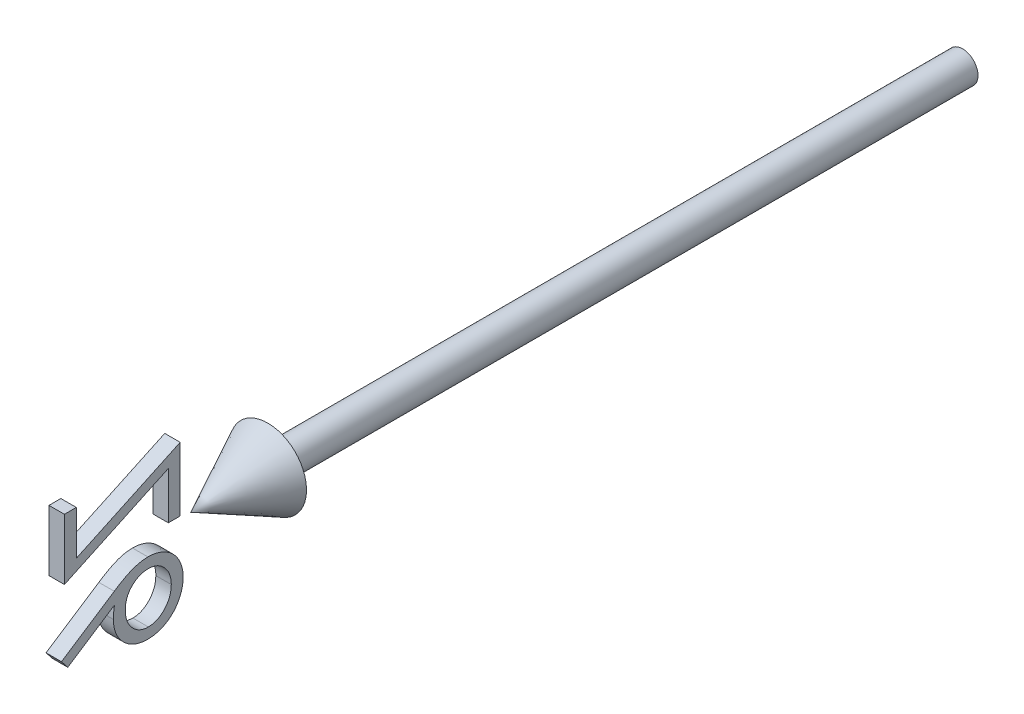
from build123d import *

# Parameters (mm, degrees)
BOSS_EXTRUDE1_DEPTH        = 1
BOSS_EXTRUDE1_DEPTH_BACK   = 1
BOSS_EXTRUDE1_2_DEPTH      = 1
BOSS_EXTRUDE1_2_DEPTH_BACK = 1


with BuildPart() as part:
    # Sketch2 → Revolve1 (revolve)
    with BuildSketch(Plane(origin=(0, 0, 0), x_dir=(1, 0, 0), z_dir=(0, 1, 0))):
        Polygon((0, -100), (5, -90), (2, -90), (2, 0), (0, 0), align=None)
    revolve(axis=Axis((0, 0, -41.949952025), (0, 0, 1)))


with BuildPart() as body_2:
    # Sketch3 → Boss-Extrude1 (new, two sides: drawn at the far end of the back side and taken through both)
    with BuildSketch(Plane(origin=(0, 0, 0), x_dir=(0, -1, 0), z_dir=(1, 0, 0)).offset(-BOSS_EXTRUDE1_DEPTH_BACK)):
        Polygon((-8.958586521, -115.829050545), (-8.958586521, -117.367512083), (-1.073971137, -117.367512083), (-7.366038444, -103.905973622), (-1.266278829, -103.905973622), (-1.266278829, -102.367512083), (-9.535509598, -102.367512083), (-3.243442291, -115.829050545), align=None)
    extrude(amount=BOSS_EXTRUDE1_DEPTH + BOSS_EXTRUDE1_DEPTH_BACK)


with BuildPart() as body_3:
    # Sketch3 → Boss-Extrude1 2 (new, two sides: drawn at the far end of the back side and taken through both)
    with BuildSketch(Plane(origin=(0, 0, 0), x_dir=(0, -1, 0), z_dir=(1, 0, 0)).offset(-BOSS_EXTRUDE1_2_DEPTH_BACK)):
        with BuildLine():
            Line((7.387567325, -117.752127468), (8.424225979, -116.937824583))
            Line((8.424225979, -116.937824583), (4.460884633, -110.877127468))
            add(Edge.make_bspline(
                [(4.460884633, -110.877127468), (4.724757248, -110.919186871), (5.23947062, -111.001228491), (5.760467328, -111.014762543), (6.014370209, -111.021358237)],
                knots=[0, 0, 0, 0, 1.025318673, 2, 2, 2, 2], degree=3))
            add(Edge.make_bspline(
                [(6.014370209, -111.021358237), (6.166823765, -111.017260616), (6.466924054, -111.00919457), (6.90752463, -110.947120922), (7.330905801, -110.849299021), (7.73531265, -110.706703612), (8.122197082, -110.524550764), (8.493777932, -110.306240944), (8.843075506, -110.040503753), (9.174568059, -109.743648397), (9.475587859, -109.414881961), (9.741888404, -109.06594444), (9.96680146, -108.696863429), (10.14599094, -108.307721927), (10.289195068, -107.901566079), (10.391138976, -107.476811849), (10.452082579, -107.032742346), (10.460310746, -106.730684026), (10.464490402, -106.57724766)],
                knots=[0, 0, 0, 0, 1.043709831, 2.054511743, 3.041122595, 4.01515914, 4.98481438, 5.965901842, 6.960491961, 7.985277438, 9.0096037, 10.00832444, 10.987059228, 11.962929573, 12.936966118, 13.931840027, 14.949438142, 16, 16, 16, 16], degree=3))
            add(Edge.make_bspline(
                [(10.464490402, -106.57724766), (10.45667713, -106.367451652), (10.441311524, -105.954866174), (10.329035926, -105.351559671), (10.136701892, -104.781755095), (9.875246254, -104.243964631), (9.542487381, -103.749450748), (9.143368233, -103.304028972), (8.679859323, -102.915781598), (8.161189367, -102.582866277), (7.599903237, -102.318327421), (7.011356352, -102.122758195), (6.40060363, -102.005898401), (5.985817631, -101.9905992), (5.776990402, -101.982896699)],
                knots=[0, 0, 0, 0, 1.0319111, 2.029359566, 3.00642934, 3.98275322, 4.962714161, 5.929339302, 6.915525103, 7.928435063, 8.953439721, 9.960121214, 10.9730072, 12, 12, 12, 12], degree=3))
            add(Edge.make_bspline(
                [(5.776990402, -101.982896699), (5.575138865, -101.989427523), (5.175306311, -102.002363943), (4.587290587, -102.118204709), (4.021275897, -102.30462607), (3.484540848, -102.566844896), (2.986473856, -102.892448584), (2.537456198, -103.281763051), (2.148849642, -103.735040812), (1.824265766, -104.243823569), (1.558647205, -104.786232305), (1.3730556, -105.357963621), (1.252389216, -105.947168564), (1.239971685, -106.348293377), (1.233721171, -106.550204391)],
                knots=[0, 0, 0, 0, 1.01206923, 2.004731945, 2.994948482, 3.995280086, 4.993424783, 5.973125358, 6.967517142, 7.97830003, 8.994392566, 9.989381197, 10.98793077, 12, 12, 12, 12], degree=3))
            add(Edge.make_bspline(
                [(1.233721171, -106.550204391), (1.239157378, -106.70462493), (1.250252135, -107.019781862), (1.316464364, -107.498476602), (1.437905683, -107.986364734), (1.569331733, -108.39996039), (1.699746048, -108.742492528), (1.820669201, -109.01298111), (1.95587602, -109.298625736), (2.114357241, -109.594021731), (2.282360125, -109.907609198), (2.478606559, -110.227775035), (2.683392728, -110.566212688), (2.833413854, -110.79153922), (2.910403863, -110.907175545)],
                knots=[0, 0, 0, 0, 1.17367173, 2.395347028, 3.66355231, 4.98980831, 5.690886799, 6.447442954, 7.240630024, 8.091733897, 8.994365608, 9.943299771, 10.944512865, 12, 12, 12, 12], degree=3))
            Line((2.910403863, -110.907175545), (7.387567325, -117.752127468))
        make_face()
        with BuildLine():
            add(Edge.make_bspline(
                [(5.731918286, -109.482896699), (5.617643803, -109.479550516), (5.393438208, -109.472985332), (5.065103103, -109.435087535), (4.754169296, -109.365723997), (4.461147017, -109.268087944), (4.181711815, -109.148801905), (3.920302291, -108.997532473), (3.675159154, -108.819642908), (3.451943564, -108.614894442), (3.246922766, -108.394145971), (3.070584936, -108.156249146), (2.918306509, -107.908518112), (2.794537717, -107.648612441), (2.698148876, -107.376701996), (2.628428562, -107.09401865), (2.589626566, -106.798671852), (2.583171317, -106.598389666), (2.579875017, -106.496117852)],
                knots=[0, 0, 0, 0, 1.129540697, 2.216149546, 3.260829642, 4.271906843, 5.264942922, 6.258225651, 7.250175744, 8.252297429, 9.247108021, 10.223125336, 11.173816288, 12.116901384, 13.062424938, 14.020354563, 14.989116641, 16, 16, 16, 16], degree=3))
            add(Edge.make_bspline(
                [(2.579875017, -106.496117852), (2.582661394, -106.394782351), (2.588152291, -106.195088315), (2.634686617, -105.901891502), (2.709592422, -105.620643662), (2.816076551, -105.350751514), (2.952112837, -105.092625416), (3.114819392, -104.843144936), (3.312115114, -104.60895095), (3.5362472, -104.388598076), (3.779792579, -104.186957186), (4.036823461, -104.006678291), (4.308262109, -103.85704324), (4.591217774, -103.731969591), (4.889245249, -103.640081796), (5.197297603, -103.569685279), (5.519619865, -103.53120966), (5.737835651, -103.524685145), (5.849105786, -103.521358237)],
                knots=[0, 0, 0, 0, 0.98953633, 1.950002717, 2.892353065, 3.828177645, 4.777967117, 5.738732544, 6.732276577, 7.76327951, 8.805689376, 9.818183401, 10.825652611, 11.829169732, 12.834974292, 13.867693979, 14.912718532, 16, 16, 16, 16], degree=3))
            add(Edge.make_bspline(
                [(5.849105786, -103.521358237), (5.960376104, -103.524684886), (6.178592248, -103.531208893), (6.500911916, -103.569688194), (6.808973852, -103.640071113), (7.106966521, -103.732008302), (7.390051273, -103.856898758), (7.661727396, -104.007621516), (7.92121244, -104.185864299), (8.164599428, -104.388946765), (8.389666859, -104.607700946), (8.582429019, -104.845285693), (8.750382815, -105.090662031), (8.88123106, -105.351778217), (8.988907437, -105.620483166), (9.063446275, -105.901935306), (9.110079809, -106.195076887), (9.115557089, -106.394778504), (9.118336556, -106.496117852)],
                knots=[0, 0, 0, 0, 1.087095469, 2.131941252, 3.164484274, 4.170116773, 5.173462224, 6.180759088, 7.201132453, 8.243363996, 9.274190558, 10.261329848, 11.227346438, 12.172477233, 13.108141724, 14.050330866, 15.010632948, 16, 16, 16, 16], degree=3))
            add(Edge.make_bspline(
                [(9.118336556, -106.496117852), (9.116005645, -106.598534958), (9.111430827, -106.799546427), (9.058685072, -107.093752554), (8.987443172, -107.379000677), (8.872309656, -107.648864907), (8.735176504, -107.910808896), (8.560476842, -108.157342971), (8.360183356, -108.395463766), (8.1282086, -108.616357657), (7.8758991, -108.818547784), (7.607372218, -108.996491975), (7.327575224, -109.14839067), (7.032553285, -109.268249571), (6.726279448, -109.36480959), (6.406637889, -109.434622935), (6.073401532, -109.473044338), (5.847195868, -109.479570748), (5.731918286, -109.482896699)],
                knots=[0, 0, 0, 0, 0.978317929, 1.920119929, 2.851929572, 3.784133089, 4.71845084, 5.67514162, 6.667477147, 7.690549442, 8.733345855, 9.756283585, 10.767808623, 11.772962645, 12.797066014, 13.836159554, 14.89727653, 16, 16, 16, 16], degree=3))
        make_face(mode=Mode.SUBTRACT)
    extrude(amount=BOSS_EXTRUDE1_2_DEPTH + BOSS_EXTRUDE1_2_DEPTH_BACK)


solid = Compound([part.part, body_2.part, body_3.part])
